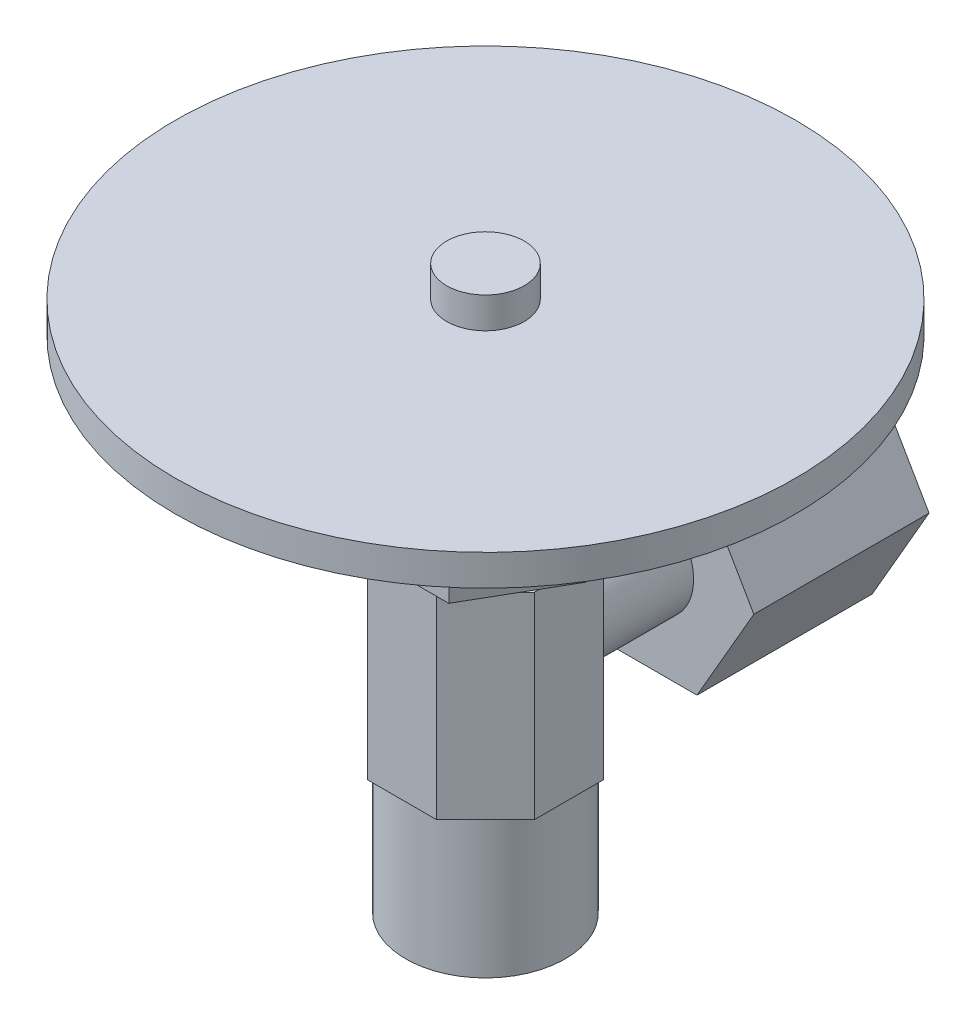
from build123d import *

# Parameters (mm, degrees)
BOSS_EXTRUDE1_DEPTH      = 12.7
BOSS_EXTRUDE2_DEPTH      = 4.6
BOSS_EXTRUDE2_DEPTH_BACK = 2
SKETCH2_R                = 3.445005279
BOSS_EXTRUDE3_DEPTH      = 11.3
SKETCH4_R                = 5.15
BOSS_EXTRUDE4_DEPTH      = 9
BOSS_EXTRUDE5_DEPTH      = 8.57
SKETCH6_R                = 2.5
BOSS_EXTRUDE6_DEPTH      = 6
BOSS_EXTRUDE7_START      = -2
SKETCH7_R                = 20
BOSS_EXTRUDE7_DEPTH      = 2


with BuildPart() as part:
    # Sketch1 → Boss-Extrude1 (new body)
    with BuildSketch(Plane(origin=(0, 0, 0), x_dir=(1, 0, 0), z_dir=(0, 1, 0))):
        Polygon((-2.226397898, -5.375), (2.226397898, -5.375), (5.375, -2.226397898), (5.375, 2.226397898), (2.226397898, 5.375), (-2.226397898, 5.375), (-5.375, 2.226397898), (-5.375, -2.226397898), align=None)
    extrude(amount=BOSS_EXTRUDE1_DEPTH)

    # Sketch2 → Boss-Extrude2 (add, two sides: drawn at the far end of the back side and taken through both)
    with BuildSketch(Plane(origin=(0, 0, -5.375), x_dir=(-1, 0, 0), z_dir=(0, 0, -1)).offset(-BOSS_EXTRUDE2_DEPTH_BACK)):
        with Locations((0, 6.35)):
            Circle(SKETCH2_R)
    extrude(amount=BOSS_EXTRUDE2_DEPTH + BOSS_EXTRUDE2_DEPTH_BACK)

    # Sketch3 → Boss-Extrude3 (add)
    with BuildSketch(Plane(origin=(0, 0, -9.975), x_dir=(-1, 0, 0), z_dir=(0, 0, -1))):
        Polygon((7.332348419, 6.35), (3.666174209, 12.7), (-3.666174209, 12.7), (-7.332348419, 6.35), (-3.666174209, 0), (3.666174209, 0), align=None)
    extrude(amount=BOSS_EXTRUDE3_DEPTH)

    # Sketch4 → Boss-Extrude4 (add)
    with BuildSketch(Plane.XZ):
        Circle(SKETCH4_R)
    extrude(amount=BOSS_EXTRUDE4_DEPTH)

    # Sketch5 → Boss-Extrude5 (add)
    with BuildSketch(Plane(origin=(0, 12.7, 0), x_dir=(1, 0, 0), z_dir=(0, 1, 0))):
        Polygon((6.466323015, 0), (3.233161507, 5.6), (-3.233161507, 5.6), (-6.466323015, 0), (-3.233161507, -5.6), (3.233161507, -5.6), align=None)
    extrude(amount=BOSS_EXTRUDE5_DEPTH)

    # Sketch6 → Boss-Extrude6 (add)
    with BuildSketch(Plane(origin=(0, 21.27, 0), x_dir=(1, 0, 0), z_dir=(0, 1, 0))):
        Circle(SKETCH6_R)
    extrude(amount=BOSS_EXTRUDE6_DEPTH)

    # Sketch7 → Boss-Extrude7 (add)
    with BuildSketch(Plane(origin=(0, 27.27, 0), x_dir=(1, 0, 0), z_dir=(0, 1, 0)).offset(BOSS_EXTRUDE7_START)):
        Circle(SKETCH7_R)
    extrude(amount=-BOSS_EXTRUDE7_DEPTH)


solid = part.part
